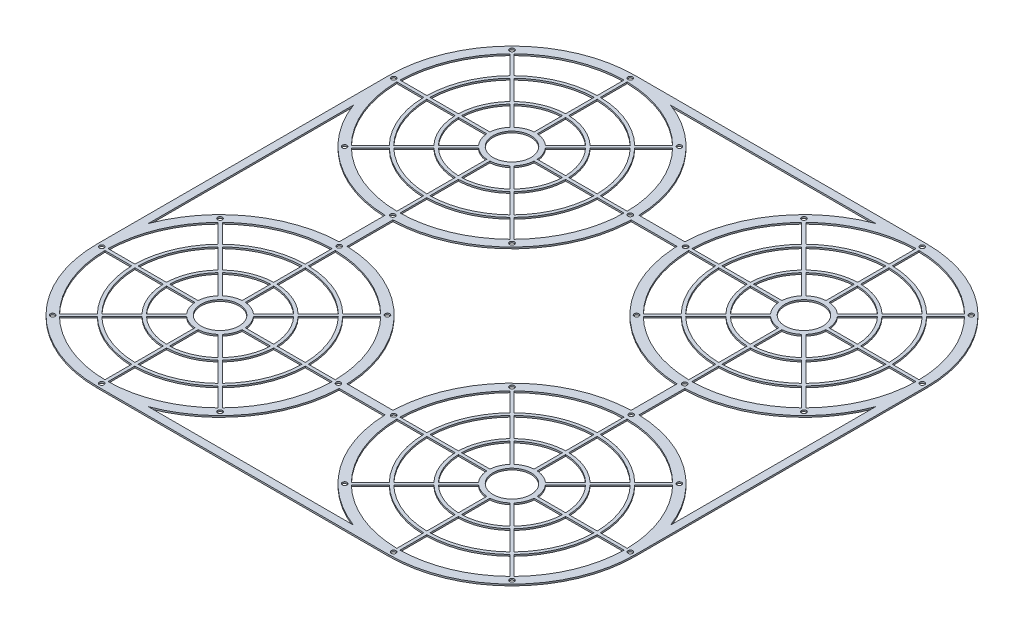
from build123d import *

# Parameters (mm, degrees)
SKETCH_1_R           = 1.5
SKETCH_1_R_2         = 12
EXTRUDE_6_DEPTH      = 1
MIRROR_4_OUTLINE_R   = 1.5
MIRROR_4_OUTLINE_R_2 = 12
MIRROR_4_DEPTH       = 1


# Read off the part's stored shape, not the designer's step: 镜向4
with BuildPart() as part:
    # 草图1 → 凸台-拉伸6 (new body)
    with BuildSketch(Plane(origin=(0, 0, 0), x_dir=(1, 0, 0), z_dir=(0, 1, 0))):
        with BuildLine():
            Line((-78, 0), (-78, -92.5))
            Line((-78, -92.5), (-73, -92.5))
            Line((-73, -92.5), (-73, -27.477263328))
            ThreePointArc((-73, -27.477263328), (-45.411312441, -63.417763303), (-2.5, -77.959925603))
            Line((-2.5, -77.959925603), (-2.5, -92.5))
            Line((-2.5, -92.5), (2.5, -92.5))
            Line((2.5, -92.5), (2.5, -77.959925603))
            ThreePointArc((2.5, -77.959925603), (54.291774743, -56.003599842), (77.844793212, -4.918146992))
            Line((77.844793212, -4.918146992), (77.959925603, -2.5))
            Line((77.959925603, -2.5), (92.5, -2.5))
            Line((92.5, -2.5), (92.5, 2.5))
            Line((92.5, 2.5), (77.959925603, 2.5))
            ThreePointArc((77.959925603, 2.5), (63.417763303, 45.411312441), (27.477263328, 73))
            Line((27.477263328, 73), (92.5, 73))
            Line((92.5, 73), (92.5, 78))
            Line((92.5, 78), (0, 78))
            ThreePointArc((0, 78), (-55.154328933, 55.154328933), (-78, 0))
        make_face()
        with Locations(Location((-53.033008589, -53.033008589, 0), (0, 0, 270))):
            Circle(SKETCH_1_R, mode=Mode.SUBTRACT)
        with BuildLine():
            ThreePointArc((-38.177337409, -39.591550972), (-21.04758878, -50.813374288), (-1, -54.990908339))
            Line((-1, -54.990908339), (-1, -71.993055221))
            ThreePointArc((-1, -71.993055221), (-27.55320713, -66.519326341), (-50.199670764, -51.613884326))
            Line((-50.199670764, -51.613884326), (-38.177337409, -39.591550972))
        make_face(mode=Mode.SUBTRACT)
        with BuildLine():
            ThreePointArc((-24.031526973, -25.445740535), (-13.393920133, -32.335783638), (-1, -34.985711369))
            Line((-1, -34.985711369), (-1, -52.990565198))
            ThreePointArc((-1, -52.990565198), (-20.282221915, -48.965615223), (-36.762881209, -38.177094772))
            Line((-36.762881209, -38.177094772), (-24.031526973, -25.445740535))
        make_face(mode=Mode.SUBTRACT)
        with BuildLine():
            Line((-71.993055221, -1), (-54.990908339, -1))
            ThreePointArc((-54.990908339, -1), (-50.813374288, -21.04758878), (-39.591550972, -38.177337409))
            Line((-39.591550972, -38.177337409), (-51.613884326, -50.199670764))
            ThreePointArc((-51.613884326, -50.199670764), (-66.519326341, -27.55320713), (-71.993055221, -1))
        make_face(mode=Mode.SUBTRACT)
        with BuildLine():
            Line((-25.445740535, -24.031526973), (-38.177094772, -36.762881209))
            ThreePointArc((-38.177094772, -36.762881209), (-48.965615223, -20.282221915), (-52.990565198, -1))
            Line((-52.990565198, -1), (-34.985711369, -1))
            ThreePointArc((-34.985711369, -1), (-32.335783638, -13.393920133), (-25.445740535, -24.031526973))
        make_face(mode=Mode.SUBTRACT)
        with BuildLine():
            ThreePointArc((-1, -32.984845005), (-12.628553268, -30.488024573), (-22.616700798, -24.030914361))
            Line((-22.616700798, -24.030914361), (-9.875898463, -11.290112025))
            ThreePointArc((-9.875898463, -11.290112025), (-5.740251485, -13.858192988), (-1, -14.966629547))
            Line((-1, -14.966629547), (-1, -32.984845005))
        make_face(mode=Mode.SUBTRACT)
        with BuildLine():
            Line((-11.290112025, -9.875898463), (-24.030914361, -22.616700798))
            ThreePointArc((-24.030914361, -22.616700798), (-30.488024573, -12.628553268), (-32.984845005, -1))
            Line((-32.984845005, -1), (-14.966629547, -1))
            ThreePointArc((-14.966629547, -1), (-13.858192988, -5.740251485), (-11.290112025, -9.875898463))
        make_face(mode=Mode.SUBTRACT)
        with Locations(Location((0, -75.549453739, 0), (0, 0, 270))):
            Circle(SKETCH_1_R, mode=Mode.SUBTRACT)
        with BuildLine():
            Line((1, -52.990565198), (1, -34.985711369))
            ThreePointArc((1, -34.985711369), (13.393920133, -32.335783638), (24.031526973, -25.445740535))
            Line((24.031526973, -25.445740535), (36.762881209, -38.177094772))
            ThreePointArc((36.762881209, -38.177094772), (20.282221915, -48.965615223), (1, -52.990565198))
        make_face(mode=Mode.SUBTRACT)
        with BuildLine():
            Line((1, -71.993055221), (1, -54.990908339))
            ThreePointArc((1, -54.990908339), (21.04758878, -50.813374288), (38.177337409, -39.591550972))
            Line((38.177337409, -39.591550972), (50.199670764, -51.613884326))
            ThreePointArc((50.199670764, -51.613884326), (27.55320713, -66.519326341), (1, -71.993055221))
        make_face(mode=Mode.SUBTRACT)
        with Locations(Location((53.033008589, -53.033008589, 0), (0, 0, 270))):
            Circle(SKETCH_1_R, mode=Mode.SUBTRACT)
        with BuildLine():
            Line((9.875898463, -11.290112025), (22.616700798, -24.030914361))
            ThreePointArc((22.616700798, -24.030914361), (12.628553268, -30.488024573), (1, -32.984845005))
            Line((1, -32.984845005), (1, -14.966629547))
            ThreePointArc((1, -14.966629547), (5.740251485, -13.858192988), (9.875898463, -11.290112025))
        make_face(mode=Mode.SUBTRACT)
        with BuildLine():
            ThreePointArc((32.984845005, -1), (30.488024573, -12.628553268), (24.030914361, -22.616700798))
            Line((24.030914361, -22.616700798), (11.290112025, -9.875898463))
            ThreePointArc((11.290112025, -9.875898463), (13.858192988, -5.740251485), (14.966629547, -1))
            Line((14.966629547, -1), (32.984845005, -1))
        make_face(mode=Mode.SUBTRACT)
        with BuildLine():
            ThreePointArc((39.591550972, -38.177337409), (50.813374288, -21.04758878), (54.990908339, -1))
            Line((54.990908339, -1), (71.993055221, -1))
            ThreePointArc((71.993055221, -1), (66.519326341, -27.55320713), (51.613884326, -50.199670764))
            Line((51.613884326, -50.199670764), (39.591550972, -38.177337409))
        make_face(mode=Mode.SUBTRACT)
        with BuildLine():
            ThreePointArc((52.990565198, -1), (48.965615223, -20.282221915), (38.177094772, -36.762881209))
            Line((38.177094772, -36.762881209), (25.445740535, -24.031526973))
            ThreePointArc((25.445740535, -24.031526973), (32.335783638, -13.393920133), (34.985711369, -1))
            Line((34.985711369, -1), (52.990565198, -1))
        make_face(mode=Mode.SUBTRACT)
        with Locations(Location((-75, 0, 0), (0, 0, 270))):
            Circle(SKETCH_1_R, mode=Mode.SUBTRACT)
        with BuildLine():
            ThreePointArc((-25.445740535, 24.031526973), (-32.335783638, 13.393920133), (-34.985711369, 1))
            Line((-34.985711369, 1), (-52.990565198, 1))
            ThreePointArc((-52.990565198, 1), (-48.965615223, 20.282221915), (-38.177094772, 36.762881209))
            Line((-38.177094772, 36.762881209), (-25.445740535, 24.031526973))
        make_face(mode=Mode.SUBTRACT)
        with BuildLine():
            ThreePointArc((-39.591550972, 38.177337409), (-50.813374288, 21.04758878), (-54.990908339, 1))
            Line((-54.990908339, 1), (-71.993055221, 1))
            ThreePointArc((-71.993055221, 1), (-66.519326341, 27.55320713), (-51.613884326, 50.199670764))
            Line((-51.613884326, 50.199670764), (-39.591550972, 38.177337409))
        make_face(mode=Mode.SUBTRACT)
        with BuildLine():
            Line((-24.030914361, 22.616700798), (-11.290112025, 9.875898463))
            ThreePointArc((-11.290112025, 9.875898463), (-13.858192988, 5.740251485), (-14.966629547, 1))
            Line((-14.966629547, 1), (-32.984845005, 1))
            ThreePointArc((-32.984845005, 1), (-30.488024573, 12.628553268), (-24.030914361, 22.616700798))
        make_face(mode=Mode.SUBTRACT)
        with Locations(Location((0, 0, 0), (0, 0, 270))):
            Circle(SKETCH_1_R_2, mode=Mode.SUBTRACT)
        with BuildLine():
            ThreePointArc((-1, 14.966629547), (-5.740251485, 13.858192988), (-9.875898463, 11.290112025))
            Line((-9.875898463, 11.290112025), (-22.616700798, 24.030914361))
            ThreePointArc((-22.616700798, 24.030914361), (-12.628553268, 30.488024573), (-1, 32.984845005))
            Line((-1, 32.984845005), (-1, 14.966629547))
        make_face(mode=Mode.SUBTRACT)
        with Locations(Location((-53.033008589, 53.033008589, 0), (0, 0, 270))):
            Circle(SKETCH_1_R, mode=Mode.SUBTRACT)
        with BuildLine():
            Line((-1, 71.993055221), (-1, 54.990908339))
            ThreePointArc((-1, 54.990908339), (-21.04758878, 50.813374288), (-38.177337409, 39.591550972))
            Line((-38.177337409, 39.591550972), (-50.199670764, 51.613884326))
            ThreePointArc((-50.199670764, 51.613884326), (-27.55320713, 66.519326341), (-1, 71.993055221))
        make_face(mode=Mode.SUBTRACT)
        with BuildLine():
            Line((-1, 52.990565198), (-1, 34.985711369))
            ThreePointArc((-1, 34.985711369), (-13.393920133, 32.335783638), (-24.031526973, 25.445740535))
            Line((-24.031526973, 25.445740535), (-36.762881209, 38.177094772))
            ThreePointArc((-36.762881209, 38.177094772), (-20.282221915, 48.965615223), (-1, 52.990565198))
        make_face(mode=Mode.SUBTRACT)
        with Locations(Location((0, 75, 0), (0, 0, 270))):
            Circle(SKETCH_1_R, mode=Mode.SUBTRACT)
        with BuildLine():
            ThreePointArc((14.966629547, 1), (13.858192988, 5.740251485), (11.290112025, 9.875898463))
            Line((11.290112025, 9.875898463), (24.030914361, 22.616700798))
            ThreePointArc((24.030914361, 22.616700798), (30.488024573, 12.628553268), (32.984845005, 1))
            Line((32.984845005, 1), (14.966629547, 1))
        make_face(mode=Mode.SUBTRACT)
        with BuildLine():
            ThreePointArc((1, 32.984845005), (12.628553268, 30.488024573), (22.616700798, 24.030914361))
            Line((22.616700798, 24.030914361), (9.875898463, 11.290112025))
            ThreePointArc((9.875898463, 11.290112025), (5.740251485, 13.858192988), (1, 14.966629547))
            Line((1, 14.966629547), (1, 32.984845005))
        make_face(mode=Mode.SUBTRACT)
        with BuildLine():
            Line((52.990565198, 1), (34.985711369, 1))
            ThreePointArc((34.985711369, 1), (32.335783638, 13.393920133), (25.445740535, 24.031526973))
            Line((25.445740535, 24.031526973), (38.177094772, 36.762881209))
            ThreePointArc((38.177094772, 36.762881209), (48.965615223, 20.282221915), (52.990565198, 1))
        make_face(mode=Mode.SUBTRACT)
        with Locations(Location((75, 0, 0), (0, 0, 270))):
            Circle(SKETCH_1_R, mode=Mode.SUBTRACT)
        with BuildLine():
            Line((71.993055221, 1), (54.990908339, 1))
            ThreePointArc((54.990908339, 1), (50.813374288, 21.04758878), (39.591550972, 38.177337409))
            Line((39.591550972, 38.177337409), (51.613884326, 50.199670764))
            ThreePointArc((51.613884326, 50.199670764), (66.519326341, 27.55320713), (71.993055221, 1))
        make_face(mode=Mode.SUBTRACT)
        with BuildLine():
            ThreePointArc((1, 52.990565198), (20.282221915, 48.965615223), (36.762881209, 38.177094772))
            Line((36.762881209, 38.177094772), (24.031526973, 25.445740535))
            ThreePointArc((24.031526973, 25.445740535), (13.393920133, 32.335783638), (1, 34.985711369))
            Line((1, 34.985711369), (1, 52.990565198))
        make_face(mode=Mode.SUBTRACT)
        with BuildLine():
            Line((1, 54.990908339), (1, 71.993055221))
            ThreePointArc((1, 71.993055221), (27.55320713, 66.519326341), (50.199670764, 51.613884326))
            Line((50.199670764, 51.613884326), (38.177337409, 39.591550972))
            ThreePointArc((38.177337409, 39.591550972), (21.04758878, 50.813374288), (1, 54.990908339))
        make_face(mode=Mode.SUBTRACT)
        with Locations(Location((53.033008589, 53.033008589, 0), (0, 0, 270))):
            Circle(SKETCH_1_R, mode=Mode.SUBTRACT)
    extrude(amount=EXTRUDE_6_DEPTH)

    # 镜向4 outline → 镜向4 (add)
    with BuildSketch(Plane(origin=(0, 0, 0), x_dir=(1, 0, 0), z_dir=(0, 1, 0))):
        with BuildLine():
            Line((92.5, 73), (157.522736672, 73))
            ThreePointArc((157.522736672, 73), (121.582236697, 45.411312441), (107.040074397, 2.5))
            Line((107.040074397, 2.5), (92.5, 2.5))
            Line((92.5, 2.5), (92.5, -2.5))
            Line((92.5, -2.5), (107.040074397, -2.5))
            Line((107.040074397, -2.5), (107.155206788, -4.918146992))
            ThreePointArc((107.155206788, -4.918146992), (130.708225257, -56.003599842), (182.5, -77.959925603))
            Line((182.5, -77.959925603), (182.5, -107.040074397))
            ThreePointArc((182.5, -107.040074397), (130.708225257, -128.996400158), (107.155206788, -180.081853008))
            Line((107.155206788, -180.081853008), (107.040074397, -182.5))
            Line((107.040074397, -182.5), (77.959925603, -182.5))
            Line((77.959925603, -182.5), (77.844793212, -180.081853008))
            ThreePointArc((77.844793212, -180.081853008), (54.291774743, -128.996400158), (2.5, -107.040074397))
            Line((2.5, -107.040074397), (2.5, -92.5))
            Line((2.5, -92.5), (-2.5, -92.5))
            Line((-2.5, -92.5), (-2.5, -107.040074397))
            ThreePointArc((-2.5, -107.040074397), (-45.411312441, -121.582236697), (-73, -157.522736672))
            Line((-73, -157.522736672), (-73, -92.5))
            Line((-73, -92.5), (-78, -92.5))
            Line((-78, -92.5), (-78, -185))
            ThreePointArc((-78, -185), (-55.154328933, -240.154328933), (0, -263))
            Line((0, -263), (185, -263))
            ThreePointArc((185, -263), (240.154328933, -240.154328933), (263, -185))
            Line((263, -185), (263, 0))
            ThreePointArc((263, 0), (240.154328933, 55.154328933), (185, 78))
            Line((185, 78), (92.5, 78))
            Line((92.5, 78), (92.5, 73))
        make_face()
        with Locations((-53.033008589, -238.033008589)):
            Circle(MIRROR_4_OUTLINE_R, mode=Mode.SUBTRACT)
        with Locations((0, -260)):
            Circle(MIRROR_4_OUTLINE_R, mode=Mode.SUBTRACT)
        with BuildLine():
            Line((-1, -239.990908339), (-1, -256.993055221))
            ThreePointArc((-1, -256.993055221), (-27.55320713, -251.519326341), (-50.199670764, -236.613884326))
            Line((-50.199670764, -236.613884326), (-38.177337409, -224.591550972))
            ThreePointArc((-38.177337409, -224.591550972), (-21.04758878, -235.813374288), (-1, -239.990908339))
        make_face(mode=Mode.SUBTRACT)
        with BuildLine():
            Line((-1, -219.985711369), (-1, -237.990565198))
            ThreePointArc((-1, -237.990565198), (-20.282221915, -233.965615223), (-36.762881209, -223.177094772))
            Line((-36.762881209, -223.177094772), (-24.031526973, -210.445740535))
            ThreePointArc((-24.031526973, -210.445740535), (-13.393920133, -217.335783638), (-1, -219.985711369))
        make_face(mode=Mode.SUBTRACT)
        with BuildLine():
            ThreePointArc((-51.613884326, -235.199670764), (-66.519326341, -212.55320713), (-71.993055221, -186))
            Line((-71.993055221, -186), (-54.990908339, -186))
            ThreePointArc((-54.990908339, -186), (-50.813374288, -206.04758878), (-39.591550972, -223.177337409))
            Line((-39.591550972, -223.177337409), (-51.613884326, -235.199670764))
        make_face(mode=Mode.SUBTRACT)
        with BuildLine():
            ThreePointArc((-38.177094772, -221.762881209), (-48.965615223, -205.282221915), (-52.990565198, -186))
            Line((-52.990565198, -186), (-34.985711369, -186))
            ThreePointArc((-34.985711369, -186), (-32.335783638, -198.393920133), (-25.445740535, -209.031526973))
            Line((-25.445740535, -209.031526973), (-38.177094772, -221.762881209))
        make_face(mode=Mode.SUBTRACT)
        with Locations((-75, -185)):
            Circle(MIRROR_4_OUTLINE_R, mode=Mode.SUBTRACT)
        with BuildLine():
            Line((-1, -199.966629547), (-1, -217.984845005))
            ThreePointArc((-1, -217.984845005), (-12.628553268, -215.488024573), (-22.616700798, -209.030914361))
            Line((-22.616700798, -209.030914361), (-9.875898463, -196.290112025))
            ThreePointArc((-9.875898463, -196.290112025), (-5.740251486, -198.858192988), (-1, -199.966629547))
        make_face(mode=Mode.SUBTRACT)
        with BuildLine():
            Line((-11.290112025, -194.875898463), (-24.030914361, -207.616700798))
            ThreePointArc((-24.030914361, -207.616700798), (-30.488024573, -197.628553268), (-32.984845005, -186))
            Line((-32.984845005, -186), (-14.966629547, -186))
            ThreePointArc((-14.966629547, -186), (-13.858192988, -190.740251486), (-11.290112025, -194.875898463))
        make_face(mode=Mode.SUBTRACT)
        with Locations((0, -185)):
            Circle(MIRROR_4_OUTLINE_R_2, mode=Mode.SUBTRACT)
        with BuildLine():
            Line((1, -256.993055221), (1, -239.990908339))
            ThreePointArc((1, -239.990908339), (21.04758878, -235.813374288), (38.177337409, -224.591550972))
            Line((38.177337409, -224.591550972), (50.199670764, -236.613884326))
            ThreePointArc((50.199670764, -236.613884326), (27.55320713, -251.519326341), (1, -256.993055221))
        make_face(mode=Mode.SUBTRACT)
        with BuildLine():
            Line((1, -237.990565198), (1, -219.985711369))
            ThreePointArc((1, -219.985711369), (13.393920133, -217.335783638), (24.031526973, -210.445740535))
            Line((24.031526973, -210.445740535), (36.762881209, -223.177094772))
            ThreePointArc((36.762881209, -223.177094772), (20.282221915, -233.965615223), (1, -237.990565198))
        make_face(mode=Mode.SUBTRACT)
        with Locations((53.033008589, -238.033008589)):
            Circle(MIRROR_4_OUTLINE_R, mode=Mode.SUBTRACT)
        with BuildLine():
            Line((1, -217.984845005), (1, -199.966629547))
            ThreePointArc((1, -199.966629547), (5.740251486, -198.858192988), (9.875898463, -196.290112025))
            Line((9.875898463, -196.290112025), (22.616700798, -209.030914361))
            ThreePointArc((22.616700798, -209.030914361), (12.628553268, -215.488024573), (1, -217.984845005))
        make_face(mode=Mode.SUBTRACT)
        with BuildLine():
            Line((34.985711369, -186), (52.990565198, -186))
            ThreePointArc((52.990565198, -186), (48.965615223, -205.282221915), (38.177094772, -221.762881209))
            Line((38.177094772, -221.762881209), (25.445740535, -209.031526973))
            ThreePointArc((25.445740535, -209.031526973), (32.335783638, -198.393920133), (34.985711369, -186))
        make_face(mode=Mode.SUBTRACT)
        with BuildLine():
            Line((14.966629547, -186), (32.984845005, -186))
            ThreePointArc((32.984845005, -186), (30.488024573, -197.628553268), (24.030914361, -207.616700798))
            Line((24.030914361, -207.616700798), (11.290112025, -194.875898463))
            ThreePointArc((11.290112025, -194.875898463), (13.858192988, -190.740251486), (14.966629547, -186))
        make_face(mode=Mode.SUBTRACT)
        with BuildLine():
            Line((54.990908339, -186), (71.993055221, -186))
            ThreePointArc((71.993055221, -186), (66.519326341, -212.55320713), (51.613884326, -235.199670764))
            Line((51.613884326, -235.199670764), (39.591550972, -223.177337409))
            ThreePointArc((39.591550972, -223.177337409), (50.813374288, -206.04758878), (54.990908339, -186))
        make_face(mode=Mode.SUBTRACT)
        with Locations((75, -185)):
            Circle(MIRROR_4_OUTLINE_R, mode=Mode.SUBTRACT)
        with BuildLine():
            Line((-54.990908339, -184), (-71.993055221, -184))
            ThreePointArc((-71.993055221, -184), (-66.519326341, -157.44679287), (-51.613884326, -134.800329236))
            Line((-51.613884326, -134.800329236), (-39.591550972, -146.822662591))
            ThreePointArc((-39.591550972, -146.822662591), (-50.813374288, -163.95241122), (-54.990908339, -184))
        make_face(mode=Mode.SUBTRACT)
        with BuildLine():
            Line((-34.985711369, -184), (-52.990565198, -184))
            ThreePointArc((-52.990565198, -184), (-48.965615223, -164.717778085), (-38.177094772, -148.237118791))
            Line((-38.177094772, -148.237118791), (-25.445740535, -160.968473027))
            ThreePointArc((-25.445740535, -160.968473027), (-32.335783638, -171.606079867), (-34.985711369, -184))
        make_face(mode=Mode.SUBTRACT)
        with BuildLine():
            Line((-14.966629547, -184), (-32.984845005, -184))
            ThreePointArc((-32.984845005, -184), (-30.488024573, -172.371446732), (-24.030914361, -162.383299202))
            Line((-24.030914361, -162.383299202), (-11.290112025, -175.124101537))
            ThreePointArc((-11.290112025, -175.124101537), (-13.858192988, -179.259748514), (-14.966629547, -184))
        make_face(mode=Mode.SUBTRACT)
        with BuildLine():
            ThreePointArc((-22.616700798, -160.969085639), (-12.628553268, -154.511975427), (-1, -152.015154995))
            Line((-1, -152.015154995), (-1, -170.033370453))
            ThreePointArc((-1, -170.033370453), (-5.740251486, -171.141807012), (-9.875898463, -173.709887975))
            Line((-9.875898463, -173.709887975), (-22.616700798, -160.969085639))
        make_face(mode=Mode.SUBTRACT)
        with BuildLine():
            ThreePointArc((-36.762881209, -146.822905228), (-20.282221915, -136.034384777), (-1, -132.009434802))
            Line((-1, -132.009434802), (-1, -150.014288631))
            ThreePointArc((-1, -150.014288631), (-13.393920133, -152.664216362), (-24.031526973, -159.554259465))
            Line((-24.031526973, -159.554259465), (-36.762881209, -146.822905228))
        make_face(mode=Mode.SUBTRACT)
        with Locations((-53.033008589, -131.966991411)):
            Circle(MIRROR_4_OUTLINE_R, mode=Mode.SUBTRACT)
        with BuildLine():
            ThreePointArc((-50.199670764, -133.386115674), (-27.55320713, -118.480673659), (-1, -113.006944779))
            Line((-1, -113.006944779), (-1, -130.009091661))
            ThreePointArc((-1, -130.009091661), (-21.04758878, -134.186625712), (-38.177337409, -145.408449028))
            Line((-38.177337409, -145.408449028), (-50.199670764, -133.386115674))
        make_face(mode=Mode.SUBTRACT)
        with Locations((0, -109.450546261)):
            Circle(MIRROR_4_OUTLINE_R, mode=Mode.SUBTRACT)
        with BuildLine():
            Line((11.290112025, -175.124101537), (24.030914361, -162.383299202))
            ThreePointArc((24.030914361, -162.383299202), (30.488024573, -172.371446732), (32.984845005, -184))
            Line((32.984845005, -184), (14.966629547, -184))
            ThreePointArc((14.966629547, -184), (13.858192988, -179.259748514), (11.290112025, -175.124101537))
        make_face(mode=Mode.SUBTRACT)
        with BuildLine():
            Line((1, -170.033370453), (1, -152.015154995))
            ThreePointArc((1, -152.015154995), (12.628553268, -154.511975427), (22.616700798, -160.969085639))
            Line((22.616700798, -160.969085639), (9.875898463, -173.709887975))
            ThreePointArc((9.875898463, -173.709887975), (5.740251486, -171.141807012), (1, -170.033370453))
        make_face(mode=Mode.SUBTRACT)
        with BuildLine():
            ThreePointArc((34.985711369, -184), (32.335783638, -171.606079867), (25.445740535, -160.968473027))
            Line((25.445740535, -160.968473027), (38.177094772, -148.237118791))
            ThreePointArc((38.177094772, -148.237118791), (48.965615223, -164.717778085), (52.990565198, -184))
            Line((52.990565198, -184), (34.985711369, -184))
        make_face(mode=Mode.SUBTRACT)
        with BuildLine():
            Line((1, -150.014288631), (1, -132.009434802))
            ThreePointArc((1, -132.009434802), (20.282221915, -136.034384777), (36.762881209, -146.822905228))
            Line((36.762881209, -146.822905228), (24.031526973, -159.554259465))
            ThreePointArc((24.031526973, -159.554259465), (13.393920133, -152.664216362), (1, -150.014288631))
        make_face(mode=Mode.SUBTRACT)
        with BuildLine():
            ThreePointArc((54.990908339, -184), (50.813374288, -163.95241122), (39.591550972, -146.822662591))
            Line((39.591550972, -146.822662591), (51.613884326, -134.800329236))
            ThreePointArc((51.613884326, -134.800329236), (66.519326341, -157.44679287), (71.993055221, -184))
            Line((71.993055221, -184), (54.990908339, -184))
        make_face(mode=Mode.SUBTRACT)
        with BuildLine():
            Line((1, -130.009091661), (1, -113.006944779))
            ThreePointArc((1, -113.006944779), (27.55320713, -118.480673659), (50.199670764, -133.386115674))
            Line((50.199670764, -133.386115674), (38.177337409, -145.408449028))
            ThreePointArc((38.177337409, -145.408449028), (21.04758878, -134.186625712), (1, -130.009091661))
        make_face(mode=Mode.SUBTRACT)
        with Locations((53.033008589, -131.966991411)):
            Circle(MIRROR_4_OUTLINE_R, mode=Mode.SUBTRACT)
        with BuildLine():
            ThreePointArc((27.477263328, -258), (63.417763303, -230.411312441), (77.959925603, -187.5))
            Line((77.959925603, -187.5), (107.040074397, -187.5))
            ThreePointArc((107.040074397, -187.5), (121.582236697, -230.411312441), (157.522736672, -258))
            Line((157.522736672, -258), (27.477263328, -258))
        make_face(mode=Mode.SUBTRACT)
        with Locations((131.966991411, -238.033008589)):
            Circle(MIRROR_4_OUTLINE_R, mode=Mode.SUBTRACT)
        with BuildLine():
            ThreePointArc((146.822662591, -224.591550972), (163.95241122, -235.813374288), (184, -239.990908339))
            Line((184, -239.990908339), (184, -256.993055221))
            ThreePointArc((184, -256.993055221), (157.44679287, -251.519326341), (134.800329236, -236.613884326))
            Line((134.800329236, -236.613884326), (146.822662591, -224.591550972))
        make_face(mode=Mode.SUBTRACT)
        with BuildLine():
            ThreePointArc((160.968473027, -210.445740535), (171.606079867, -217.335783638), (184, -219.985711369))
            Line((184, -219.985711369), (184, -237.990565198))
            ThreePointArc((184, -237.990565198), (164.717778085, -233.965615223), (148.237118791, -223.177094772))
            Line((148.237118791, -223.177094772), (160.968473027, -210.445740535))
        make_face(mode=Mode.SUBTRACT)
        with BuildLine():
            ThreePointArc((133.386115674, -235.199670764), (118.480673659, -212.55320713), (113.006944779, -186))
            Line((113.006944779, -186), (130.009091661, -186))
            ThreePointArc((130.009091661, -186), (134.186625712, -206.04758878), (145.408449028, -223.177337409))
            Line((145.408449028, -223.177337409), (133.386115674, -235.199670764))
        make_face(mode=Mode.SUBTRACT)
        with Locations((110, -185)):
            Circle(MIRROR_4_OUTLINE_R, mode=Mode.SUBTRACT)
        with BuildLine():
            ThreePointArc((146.822905228, -221.762881209), (136.034384777, -205.282221915), (132.009434802, -186))
            Line((132.009434802, -186), (150.014288631, -186))
            ThreePointArc((150.014288631, -186), (152.664216362, -198.393920133), (159.554259465, -209.031526973))
            Line((159.554259465, -209.031526973), (146.822905228, -221.762881209))
        make_face(mode=Mode.SUBTRACT)
        with BuildLine():
            ThreePointArc((175.124101537, -196.290112025), (179.259748514, -198.858192988), (184, -199.966629547))
            Line((184, -199.966629547), (184, -217.984845005))
            ThreePointArc((184, -217.984845005), (172.371446732, -215.488024573), (162.383299202, -209.030914361))
            Line((162.383299202, -209.030914361), (175.124101537, -196.290112025))
        make_face(mode=Mode.SUBTRACT)
        with BuildLine():
            ThreePointArc((160.969085639, -207.616700798), (154.511975427, -197.628553268), (152.015154995, -186))
            Line((152.015154995, -186), (170.033370453, -186))
            ThreePointArc((170.033370453, -186), (171.141807012, -190.740251486), (173.709887975, -194.875898463))
            Line((173.709887975, -194.875898463), (160.969085639, -207.616700798))
        make_face(mode=Mode.SUBTRACT)
        with Locations((185, -260)):
            Circle(MIRROR_4_OUTLINE_R, mode=Mode.SUBTRACT)
        with BuildLine():
            Line((223.177337409, -224.591550972), (235.199670764, -236.613884326))
            ThreePointArc((235.199670764, -236.613884326), (212.55320713, -251.519326341), (186, -256.993055221))
            Line((186, -256.993055221), (186, -239.990908339))
            ThreePointArc((186, -239.990908339), (206.04758878, -235.813374288), (223.177337409, -224.591550972))
        make_face(mode=Mode.SUBTRACT)
        with BuildLine():
            Line((209.031526973, -210.445740535), (221.762881209, -223.177094772))
            ThreePointArc((221.762881209, -223.177094772), (205.282221915, -233.965615223), (186, -237.990565198))
            Line((186, -237.990565198), (186, -219.985711369))
            ThreePointArc((186, -219.985711369), (198.393920133, -217.335783638), (209.031526973, -210.445740535))
        make_face(mode=Mode.SUBTRACT)
        with Locations((238.033008589, -238.033008589)):
            Circle(MIRROR_4_OUTLINE_R, mode=Mode.SUBTRACT)
        with BuildLine():
            Line((194.875898463, -196.290112025), (207.616700798, -209.030914361))
            ThreePointArc((207.616700798, -209.030914361), (197.628553268, -215.488024573), (186, -217.984845005))
            Line((186, -217.984845005), (186, -199.966629547))
            ThreePointArc((186, -199.966629547), (190.740251486, -198.858192988), (194.875898463, -196.290112025))
        make_face(mode=Mode.SUBTRACT)
        with Locations((185, -185)):
            Circle(MIRROR_4_OUTLINE_R_2, mode=Mode.SUBTRACT)
        with BuildLine():
            ThreePointArc((217.984845005, -186), (215.488024573, -197.628553268), (209.030914361, -207.616700798))
            Line((209.030914361, -207.616700798), (196.290112025, -194.875898463))
            ThreePointArc((196.290112025, -194.875898463), (198.858192988, -190.740251486), (199.966629547, -186))
            Line((199.966629547, -186), (217.984845005, -186))
        make_face(mode=Mode.SUBTRACT)
        with BuildLine():
            ThreePointArc((256.993055221, -186), (251.519326341, -212.55320713), (236.613884326, -235.199670764))
            Line((236.613884326, -235.199670764), (224.591550972, -223.177337409))
            ThreePointArc((224.591550972, -223.177337409), (235.813374288, -206.04758878), (239.990908339, -186))
            Line((239.990908339, -186), (256.993055221, -186))
        make_face(mode=Mode.SUBTRACT)
        with BuildLine():
            ThreePointArc((237.990565198, -186), (233.965615223, -205.282221915), (223.177094772, -221.762881209))
            Line((223.177094772, -221.762881209), (210.445740535, -209.031526973))
            ThreePointArc((210.445740535, -209.031526973), (217.335783638, -198.393920133), (219.985711369, -186))
            Line((219.985711369, -186), (237.990565198, -186))
        make_face(mode=Mode.SUBTRACT)
        with Locations((260, -185)):
            Circle(MIRROR_4_OUTLINE_R, mode=Mode.SUBTRACT)
        with BuildLine():
            Line((133.386115674, -134.800329236), (145.408449028, -146.822662591))
            ThreePointArc((145.408449028, -146.822662591), (134.186625712, -163.95241122), (130.009091661, -184))
            Line((130.009091661, -184), (113.006944779, -184))
            ThreePointArc((113.006944779, -184), (118.480673659, -157.44679287), (133.386115674, -134.800329236))
        make_face(mode=Mode.SUBTRACT)
        with BuildLine():
            Line((146.822905228, -148.237118791), (159.554259465, -160.968473027))
            ThreePointArc((159.554259465, -160.968473027), (152.664216362, -171.606079867), (150.014288631, -184))
            Line((150.014288631, -184), (132.009434802, -184))
            ThreePointArc((132.009434802, -184), (136.034384777, -164.717778085), (146.822905228, -148.237118791))
        make_face(mode=Mode.SUBTRACT)
        with BuildLine():
            Line((160.969085639, -162.383299202), (173.709887975, -175.124101537))
            ThreePointArc((173.709887975, -175.124101537), (171.141807012, -179.259748514), (170.033370453, -184))
            Line((170.033370453, -184), (152.015154995, -184))
            ThreePointArc((152.015154995, -184), (154.511975427, -172.371446732), (160.969085639, -162.383299202))
        make_face(mode=Mode.SUBTRACT)
        with BuildLine():
            ThreePointArc((184, -170.033370453), (179.259748514, -171.141807012), (175.124101537, -173.709887975))
            Line((175.124101537, -173.709887975), (162.383299202, -160.969085639))
            ThreePointArc((162.383299202, -160.969085639), (172.371446732, -154.511975427), (184, -152.015154995))
            Line((184, -152.015154995), (184, -170.033370453))
        make_face(mode=Mode.SUBTRACT)
        with BuildLine():
            ThreePointArc((184, -150.014288631), (171.606079867, -152.664216362), (160.968473027, -159.554259465))
            Line((160.968473027, -159.554259465), (148.237118791, -146.822905228))
            ThreePointArc((148.237118791, -146.822905228), (164.717778085, -136.034384777), (184, -132.009434802))
            Line((184, -132.009434802), (184, -150.014288631))
        make_face(mode=Mode.SUBTRACT)
        with Locations((131.966991411, -131.966991411)):
            Circle(MIRROR_4_OUTLINE_R, mode=Mode.SUBTRACT)
        with BuildLine():
            ThreePointArc((184, -130.009091661), (163.95241122, -134.186625712), (146.822662591, -145.408449028))
            Line((146.822662591, -145.408449028), (134.800329236, -133.386115674))
            ThreePointArc((134.800329236, -133.386115674), (157.44679287, -118.480673659), (184, -113.006944779))
            Line((184, -113.006944779), (184, -130.009091661))
        make_face(mode=Mode.SUBTRACT)
        with BuildLine():
            Line((186, -170.033370453), (186, -152.015154995))
            ThreePointArc((186, -152.015154995), (197.628553268, -154.511975427), (207.616700798, -160.969085639))
            Line((207.616700798, -160.969085639), (194.875898463, -173.709887975))
            ThreePointArc((194.875898463, -173.709887975), (190.740251486, -171.141807012), (186, -170.033370453))
        make_face(mode=Mode.SUBTRACT)
        with BuildLine():
            ThreePointArc((209.030914361, -162.383299202), (215.488024573, -172.371446732), (217.984845005, -184))
            Line((217.984845005, -184), (199.966629547, -184))
            ThreePointArc((199.966629547, -184), (198.858192988, -179.259748514), (196.290112025, -175.124101537))
            Line((196.290112025, -175.124101537), (209.030914361, -162.383299202))
        make_face(mode=Mode.SUBTRACT)
        with BuildLine():
            Line((186, -150.014288631), (186, -132.009434802))
            ThreePointArc((186, -132.009434802), (205.282221915, -136.034384777), (221.762881209, -146.822905228))
            Line((221.762881209, -146.822905228), (209.031526973, -159.554259465))
            ThreePointArc((209.031526973, -159.554259465), (198.393920133, -152.664216362), (186, -150.014288631))
        make_face(mode=Mode.SUBTRACT)
        with BuildLine():
            ThreePointArc((223.177094772, -148.237118791), (233.965615223, -164.717778085), (237.990565198, -184))
            Line((237.990565198, -184), (219.985711369, -184))
            ThreePointArc((219.985711369, -184), (217.335783638, -171.606079867), (210.445740535, -160.968473027))
            Line((210.445740535, -160.968473027), (223.177094772, -148.237118791))
        make_face(mode=Mode.SUBTRACT)
        with BuildLine():
            ThreePointArc((236.613884326, -134.800329236), (251.519326341, -157.44679287), (256.993055221, -184))
            Line((256.993055221, -184), (239.990908339, -184))
            ThreePointArc((239.990908339, -184), (235.813374288, -163.95241122), (224.591550972, -146.822662591))
            Line((224.591550972, -146.822662591), (236.613884326, -134.800329236))
        make_face(mode=Mode.SUBTRACT)
        with BuildLine():
            Line((186, -130.009091661), (186, -113.006944779))
            ThreePointArc((186, -113.006944779), (212.55320713, -118.480673659), (235.199670764, -133.386115674))
            Line((235.199670764, -133.386115674), (223.177337409, -145.408449028))
            ThreePointArc((223.177337409, -145.408449028), (206.04758878, -134.186625712), (186, -130.009091661))
        make_face(mode=Mode.SUBTRACT)
        with Locations((185, -109.450546261)):
            Circle(MIRROR_4_OUTLINE_R, mode=Mode.SUBTRACT)
        with Locations((238.033008589, -131.966991411)):
            Circle(MIRROR_4_OUTLINE_R, mode=Mode.SUBTRACT)
        with Locations((131.966991411, -53.033008589)):
            Circle(MIRROR_4_OUTLINE_R, mode=Mode.SUBTRACT)
        with BuildLine():
            Line((134.800329236, -51.613884326), (146.822662591, -39.591550972))
            ThreePointArc((146.822662591, -39.591550972), (163.95241122, -50.813374288), (184, -54.990908339))
            Line((184, -54.990908339), (184, -71.993055221))
            ThreePointArc((184, -71.993055221), (157.44679287, -66.519326341), (134.800329236, -51.613884326))
        make_face(mode=Mode.SUBTRACT)
        with BuildLine():
            ThreePointArc((133.386115674, -50.199670764), (118.480673659, -27.55320713), (113.006944779, -1))
            Line((113.006944779, -1), (130.009091661, -1))
            ThreePointArc((130.009091661, -1), (134.186625712, -21.04758878), (145.408449028, -38.177337409))
            Line((145.408449028, -38.177337409), (133.386115674, -50.199670764))
        make_face(mode=Mode.SUBTRACT)
        with BuildLine():
            Line((148.237118791, -38.177094772), (160.968473027, -25.445740535))
            ThreePointArc((160.968473027, -25.445740535), (171.606079867, -32.335783638), (184, -34.985711369))
            Line((184, -34.985711369), (184, -52.990565198))
            ThreePointArc((184, -52.990565198), (164.717778085, -48.965615223), (148.237118791, -38.177094772))
        make_face(mode=Mode.SUBTRACT)
        with BuildLine():
            ThreePointArc((146.822905228, -36.762881209), (136.034384777, -20.282221915), (132.009434802, -1))
            Line((132.009434802, -1), (150.014288631, -1))
            ThreePointArc((150.014288631, -1), (152.664216362, -13.393920133), (159.554259465, -24.031526973))
            Line((159.554259465, -24.031526973), (146.822905228, -36.762881209))
        make_face(mode=Mode.SUBTRACT)
        with BuildLine():
            Line((162.383299202, -24.030914361), (175.124101537, -11.290112025))
            ThreePointArc((175.124101537, -11.290112025), (179.259748514, -13.858192988), (184, -14.966629547))
            Line((184, -14.966629547), (184, -32.984845005))
            ThreePointArc((184, -32.984845005), (172.371446732, -30.488024573), (162.383299202, -24.030914361))
        make_face(mode=Mode.SUBTRACT)
        with BuildLine():
            ThreePointArc((160.969085639, -22.616700798), (154.511975427, -12.628553268), (152.015154995, -1))
            Line((152.015154995, -1), (170.033370453, -1))
            ThreePointArc((170.033370453, -1), (171.141807012, -5.740251486), (173.709887975, -9.875898463))
            Line((173.709887975, -9.875898463), (160.969085639, -22.616700798))
        make_face(mode=Mode.SUBTRACT)
        with Locations((185, -75.549453739)):
            Circle(MIRROR_4_OUTLINE_R, mode=Mode.SUBTRACT)
        with BuildLine():
            ThreePointArc((235.199670764, -51.613884326), (212.55320713, -66.519326341), (186, -71.993055221))
            Line((186, -71.993055221), (186, -54.990908339))
            ThreePointArc((186, -54.990908339), (206.04758878, -50.813374288), (223.177337409, -39.591550972))
            Line((223.177337409, -39.591550972), (235.199670764, -51.613884326))
        make_face(mode=Mode.SUBTRACT)
        with BuildLine():
            ThreePointArc((187.5, -77.959925603), (230.411312441, -63.417763303), (258, -27.477263328))
            Line((258, -27.477263328), (258, -157.522736672))
            ThreePointArc((258, -157.522736672), (230.411312441, -121.582236697), (187.5, -107.040074397))
            Line((187.5, -107.040074397), (187.5, -77.959925603))
        make_face(mode=Mode.SUBTRACT)
        with Locations((238.033008589, -53.033008589)):
            Circle(MIRROR_4_OUTLINE_R, mode=Mode.SUBTRACT)
        with BuildLine():
            ThreePointArc((221.762881209, -38.177094772), (205.282221915, -48.965615223), (186, -52.990565198))
            Line((186, -52.990565198), (186, -34.985711369))
            ThreePointArc((186, -34.985711369), (198.393920133, -32.335783638), (209.031526973, -25.445740535))
            Line((209.031526973, -25.445740535), (221.762881209, -38.177094772))
        make_face(mode=Mode.SUBTRACT)
        with BuildLine():
            ThreePointArc((207.616700798, -24.030914361), (197.628553268, -30.488024573), (186, -32.984845005))
            Line((186, -32.984845005), (186, -14.966629547))
            ThreePointArc((186, -14.966629547), (190.740251486, -13.858192988), (194.875898463, -11.290112025))
            Line((194.875898463, -11.290112025), (207.616700798, -24.030914361))
        make_face(mode=Mode.SUBTRACT)
        with BuildLine():
            Line((199.966629547, -1), (217.984845005, -1))
            ThreePointArc((217.984845005, -1), (215.488024573, -12.628553268), (209.030914361, -22.616700798))
            Line((209.030914361, -22.616700798), (196.290112025, -9.875898463))
            ThreePointArc((196.290112025, -9.875898463), (198.858192988, -5.740251486), (199.966629547, -1))
        make_face(mode=Mode.SUBTRACT)
        with BuildLine():
            Line((219.985711369, -1), (237.990565198, -1))
            ThreePointArc((237.990565198, -1), (233.965615223, -20.282221915), (223.177094772, -36.762881209))
            Line((223.177094772, -36.762881209), (210.445740535, -24.031526973))
            ThreePointArc((210.445740535, -24.031526973), (217.335783638, -13.393920133), (219.985711369, -1))
        make_face(mode=Mode.SUBTRACT)
        with BuildLine():
            Line((239.990908339, -1), (256.993055221, -1))
            ThreePointArc((256.993055221, -1), (251.519326341, -27.55320713), (236.613884326, -50.199670764))
            Line((236.613884326, -50.199670764), (224.591550972, -38.177337409))
            ThreePointArc((224.591550972, -38.177337409), (235.813374288, -21.04758878), (239.990908339, -1))
        make_face(mode=Mode.SUBTRACT)
        with Locations((110, 0)):
            Circle(MIRROR_4_OUTLINE_R, mode=Mode.SUBTRACT)
        with BuildLine():
            Line((130.009091661, 1), (113.006944779, 1))
            ThreePointArc((113.006944779, 1), (118.480673659, 27.55320713), (133.386115674, 50.199670764))
            Line((133.386115674, 50.199670764), (145.408449028, 38.177337409))
            ThreePointArc((145.408449028, 38.177337409), (134.186625712, 21.04758878), (130.009091661, 1))
        make_face(mode=Mode.SUBTRACT)
        with BuildLine():
            Line((170.033370453, 1), (152.015154995, 1))
            ThreePointArc((152.015154995, 1), (154.511975427, 12.628553268), (160.969085639, 22.616700798))
            Line((160.969085639, 22.616700798), (173.709887975, 9.875898463))
            ThreePointArc((173.709887975, 9.875898463), (171.141807012, 5.740251486), (170.033370453, 1))
        make_face(mode=Mode.SUBTRACT)
        with BuildLine():
            Line((150.014288631, 1), (132.009434802, 1))
            ThreePointArc((132.009434802, 1), (136.034384777, 20.282221915), (146.822905228, 36.762881209))
            Line((146.822905228, 36.762881209), (159.554259465, 24.031526973))
            ThreePointArc((159.554259465, 24.031526973), (152.664216362, 13.393920133), (150.014288631, 1))
        make_face(mode=Mode.SUBTRACT)
        with BuildLine():
            Line((175.124101537, 11.290112025), (162.383299202, 24.030914361))
            ThreePointArc((162.383299202, 24.030914361), (172.371446732, 30.488024573), (184, 32.984845005))
            Line((184, 32.984845005), (184, 14.966629547))
            ThreePointArc((184, 14.966629547), (179.259748514, 13.858192988), (175.124101537, 11.290112025))
        make_face(mode=Mode.SUBTRACT)
        with Locations((131.966991411, 53.033008589)):
            Circle(MIRROR_4_OUTLINE_R, mode=Mode.SUBTRACT)
        with BuildLine():
            Line((160.968473027, 25.445740535), (148.237118791, 38.177094772))
            ThreePointArc((148.237118791, 38.177094772), (164.717778085, 48.965615223), (184, 52.990565198))
            Line((184, 52.990565198), (184, 34.985711369))
            ThreePointArc((184, 34.985711369), (171.606079867, 32.335783638), (160.968473027, 25.445740535))
        make_face(mode=Mode.SUBTRACT)
        with BuildLine():
            ThreePointArc((184, 54.990908339), (163.95241122, 50.813374288), (146.822662591, 39.591550972))
            Line((146.822662591, 39.591550972), (134.800329236, 51.613884326))
            ThreePointArc((134.800329236, 51.613884326), (157.44679287, 66.519326341), (184, 71.993055221))
            Line((184, 71.993055221), (184, 54.990908339))
        make_face(mode=Mode.SUBTRACT)
        with Locations((185, 0)):
            Circle(MIRROR_4_OUTLINE_R_2, mode=Mode.SUBTRACT)
        with BuildLine():
            ThreePointArc((209.030914361, 22.616700798), (215.488024573, 12.628553268), (217.984845005, 1))
            Line((217.984845005, 1), (199.966629547, 1))
            ThreePointArc((199.966629547, 1), (198.858192988, 5.740251486), (196.290112025, 9.875898463))
            Line((196.290112025, 9.875898463), (209.030914361, 22.616700798))
        make_face(mode=Mode.SUBTRACT)
        with BuildLine():
            ThreePointArc((186, 32.984845005), (197.628553268, 30.488024573), (207.616700798, 24.030914361))
            Line((207.616700798, 24.030914361), (194.875898463, 11.290112025))
            ThreePointArc((194.875898463, 11.290112025), (190.740251486, 13.858192988), (186, 14.966629547))
            Line((186, 14.966629547), (186, 32.984845005))
        make_face(mode=Mode.SUBTRACT)
        with Locations((260, 0)):
            Circle(MIRROR_4_OUTLINE_R, mode=Mode.SUBTRACT)
        with BuildLine():
            ThreePointArc((223.177094772, 36.762881209), (233.965615223, 20.282221915), (237.990565198, 1))
            Line((237.990565198, 1), (219.985711369, 1))
            ThreePointArc((219.985711369, 1), (217.335783638, 13.393920133), (210.445740535, 24.031526973))
            Line((210.445740535, 24.031526973), (223.177094772, 36.762881209))
        make_face(mode=Mode.SUBTRACT)
        with BuildLine():
            ThreePointArc((236.613884326, 50.199670764), (251.519326341, 27.55320713), (256.993055221, 1))
            Line((256.993055221, 1), (239.990908339, 1))
            ThreePointArc((239.990908339, 1), (235.813374288, 21.04758878), (224.591550972, 38.177337409))
            Line((224.591550972, 38.177337409), (236.613884326, 50.199670764))
        make_face(mode=Mode.SUBTRACT)
        with BuildLine():
            ThreePointArc((186, 52.990565198), (205.282221915, 48.965615223), (221.762881209, 38.177094772))
            Line((221.762881209, 38.177094772), (209.031526973, 25.445740535))
            ThreePointArc((209.031526973, 25.445740535), (198.393920133, 32.335783638), (186, 34.985711369))
            Line((186, 34.985711369), (186, 52.990565198))
        make_face(mode=Mode.SUBTRACT)
        with BuildLine():
            ThreePointArc((186, 71.993055221), (212.55320713, 66.519326341), (235.199670764, 51.613884326))
            Line((235.199670764, 51.613884326), (223.177337409, 39.591550972))
            ThreePointArc((223.177337409, 39.591550972), (206.04758878, 50.813374288), (186, 54.990908339))
            Line((186, 54.990908339), (186, 71.993055221))
        make_face(mode=Mode.SUBTRACT)
        with Locations((185, 75)):
            Circle(MIRROR_4_OUTLINE_R, mode=Mode.SUBTRACT)
        with Locations((238.033008589, 53.033008589)):
            Circle(MIRROR_4_OUTLINE_R, mode=Mode.SUBTRACT)
    extrude(amount=MIRROR_4_DEPTH)


solid = part.part
